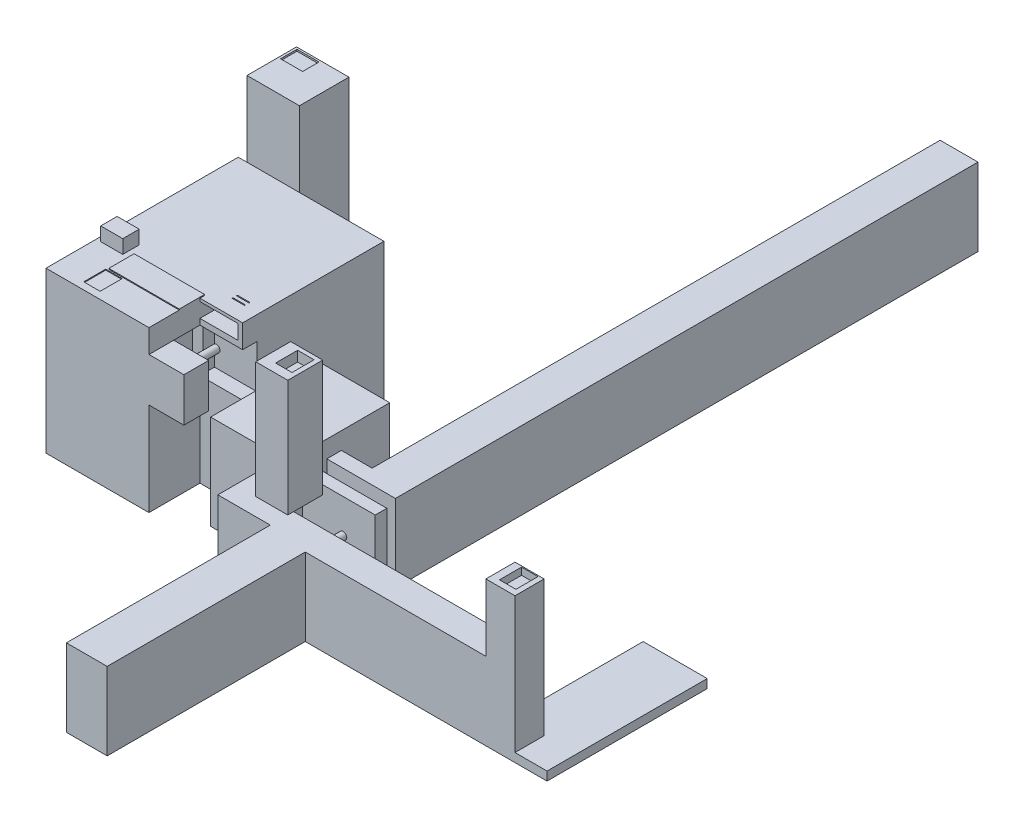
from build123d import *

# Parameters (mm, degrees)
SKETCH1_W            = 500
SKETCH1_H            = 500
BOSS_EXTRUDE1_DEPTH  = 550
SKETCH2_W            = 75.8
SKETCH2_H            = 56.4
BOSS_EXTRUDE2_DEPTH  = 46.8
SKETCH5_W            = 31
SKETCH5_H            = 3.15
BOSS_EXTRUDE4_DEPTH  = 242
SKETCH6_W            = 146.6
SKETCH6_H            = 15
CUT_EXTRUDE2_DEPTH   = 654.834841531
SKETCH7_W            = 353.4
SKETCH7_H            = 550
BOSS_EXTRUDE5_DEPTH  = 160
SKETCH8_W            = 242
SKETCH8_H            = 3.15
BOSS_EXTRUDE6_DEPTH  = 55.8
SKETCH9_W            = 56.4
SKETCH9_H            = 75.8
CUT_EXTRUDE3_DEPTH   = 3.25
CUT_EXTRUDE6_DEPTH   = 10
SKETCH13_W           = 130
SKETCH13_H           = 50
CUT_EXTRUDE7_DEPTH   = 130
LPATTERN1_COUNT      = 2
LPATTERN1_PITCH      = 15
SKETCH14_W           = 146.6
SKETCH14_H           = 150
CUT_EXTRUDE8_DEPTH   = 50
SKETCH15_W           = 350
SKETCH15_H           = 325
BOSS_EXTRUDE7_DEPTH  = 265
SKETCH16_W           = 50
SKETCH16_H           = 266.2
BOSS_EXTRUDE8_DEPTH  = 235.5
SKETCH17_W           = 130
SKETCH17_H           = 266.2
BOSS_EXTRUDE9_DEPTH  = 1950
SKETCH18_W           = 80
SKETCH18_H           = 266.2
BOSS_EXTRUDE10_DEPTH = 160
SKETCH19_W           = 780
SKETCH19_H           = 266.2
BOSS_EXTRUDE11_DEPTH = 240
SKETCH20_W           = 700
SKETCH20_H           = 266.2
CUT_EXTRUDE9_DEPTH   = 100
SKETCH21_W           = 100
SKETCH21_H           = 266.2
BOSS_EXTRUDE12_DEPTH = 720
SKETCH22_W           = 100
SKETCH22_H           = 100
BOSS_EXTRUDE14_DEPTH = 230
SKETCH23_W           = 56.4
SKETCH23_H           = 75.8
CUT_EXTRUDE10_DEPTH  = 24.4
SKETCH24_W           = 40
SKETCH24_H           = 266.2
BOSS_EXTRUDE15_DEPTH = 250
BOSS_EXTRUDE16_REACH = 2623.994
SKETCH25_R           = 12.5
SKETCH26_W           = 110
SKETCH26_H           = 120
BOSS_EXTRUDE22_DEPTH = 365.6
SKETCH28_W           = 110
SKETCH28_H           = 120
SKETCH28_W_2         = 56.4
SKETCH28_H_2         = 75.8
BOSS_EXTRUDE23_DEPTH = 35
SKETCH29_W           = 100
SKETCH29_H           = 150
CUT_EXTRUDE11_DEPTH  = 35
SKETCH30_W           = 85
SKETCH30_H           = 150
BOSS_EXTRUDE24_DEPTH = 120
BOSS_EXTRUDE25_REACH = 2664.563
SKETCH31_R           = 12.5
SKETCH32_W           = 220
SKETCH32_H           = 550
BOSS_EXTRUDE26_DEPTH = 30
SKETCH34_W           = 180
SKETCH34_H           = 808
BOSS_EXTRUDE28_DEPTH = 170
SKETCH35_W           = 75.8
SKETCH35_H           = 56.4
CUT_EXTRUDE12_DEPTH  = 5.8


with BuildPart() as part:
    # Sketch1 → Boss-Extrude1 (new body)
    with BuildSketch(Plane(origin=(0, 0, 0), x_dir=(1, 0, 0), z_dir=(0, 1, 0))):
        Rectangle(SKETCH1_W, SKETCH1_H)
    extrude(amount=BOSS_EXTRUDE1_DEPTH)

    # Sketch2 → Boss-Extrude2 (add)
    with BuildSketch(Plane(origin=(0, 550, 0), x_dir=(1, 0, 0), z_dir=(0, 1, 0))):
        with Locations((-197.1, -209)):
            Rectangle(SKETCH2_W, SKETCH2_H)
    extrude(amount=BOSS_EXTRUDE2_DEPTH)

    # Sketch5 → Boss-Extrude4 (add)
    with BuildSketch(Plane(origin=(-138.6, 0, 0), x_dir=(0, 0, -1), z_dir=(1, 0, 0))):
        with Locations((-234.5, 551.575)):
            Rectangle(SKETCH5_W, SKETCH5_H)
    extrude(amount=BOSS_EXTRUDE4_DEPTH)

    # Sketch6 → Cut-Extrude2 (cut, through all)
    with BuildSketch(Plane(origin=(0, 550, 0), x_dir=(1, 0, 0), z_dir=(0, 1, 0))):
        with Locations((176.7, -242.5)):
            Rectangle(SKETCH6_W, SKETCH6_H)
    extrude(amount=-CUT_EXTRUDE2_DEPTH, mode=Mode.SUBTRACT)

    # Sketch7 → Boss-Extrude5 (add)
    with BuildSketch(Plane.XY.offset(250)):
        with Locations((-73.3, 275)):
            Rectangle(SKETCH7_W, SKETCH7_H)
    extrude(amount=BOSS_EXTRUDE5_DEPTH)

    # Sketch8 → Boss-Extrude6 (add)
    with BuildSketch(Plane.XY.offset(250)):
        with Locations((-17.6, 551.575)):
            Rectangle(SKETCH8_W, SKETCH8_H)
    extrude(amount=BOSS_EXTRUDE6_DEPTH)

    # Sketch9 → Cut-Extrude3 (cut)
    with BuildSketch(Plane(origin=(0, 550, 0), x_dir=(1, 0, 0), z_dir=(0, 1, 0))):
        with Locations((-116.6, -347.9)):
            Rectangle(SKETCH9_W, SKETCH9_H)
    extrude(amount=-CUT_EXTRUDE3_DEPTH, mode=Mode.SUBTRACT)

    # Sketch12 → Cut-Extrude6 (cut)
    with BuildSketch(Plane(origin=(0, 550, 0), x_dir=(1, 0, 0), z_dir=(0, 1, 0))):
        with BuildLine():
            Line((200, -176.7), (160, -176.7))
            ThreePointArc((160, -176.7), (158.3, -178.4), (160, -180.1))
            Line((160, -180.1), (200, -180.1))
            ThreePointArc((200, -180.1), (201.7, -178.4), (200, -176.7))
        make_face()
    cut_extrude6 = extrude(amount=-CUT_EXTRUDE6_DEPTH, mode=Mode.SUBTRACT)

    # Sketch13 → Cut-Extrude7 (cut)
    with BuildSketch(Plane.XY.offset(235)):
        with Locations((168.4, 515)):
            Rectangle(SKETCH13_W, SKETCH13_H)
    extrude(amount=-CUT_EXTRUDE7_DEPTH, mode=Mode.SUBTRACT)

    # LPattern1: Cut-Extrude6 ×2
    with Locations(*[(0, 0, -i * LPATTERN1_PITCH) for i in range(1, LPATTERN1_COUNT)]):
        add(cut_extrude6, mode=Mode.SUBTRACT)

    # Sketch14 → Cut-Extrude8 (cut)
    with BuildSketch(Plane.XY.offset(235)):
        with Locations((176.7, 395)):
            Rectangle(SKETCH14_W, SKETCH14_H)
    extrude(amount=-CUT_EXTRUDE8_DEPTH, mode=Mode.SUBTRACT)

    # Sketch15 → Boss-Extrude7 (add)
    with BuildSketch(Plane(origin=(250, 0, 0), x_dir=(0, 0, -1), z_dir=(1, 0, 0))):
        with Locations((-170, 162.5)):
            Rectangle(SKETCH15_W, SKETCH15_H)
    extrude(amount=BOSS_EXTRUDE7_DEPTH)

    # Sketch16 → Boss-Extrude8 (add)
    with BuildSketch(Plane(origin=(515, 0, 0), x_dir=(0, 0, -1), z_dir=(1, 0, 0))):
        with Locations((-186, 133.1)):
            Rectangle(SKETCH16_W, SKETCH16_H)
    extrude(amount=BOSS_EXTRUDE8_DEPTH)

    # Sketch17 → Boss-Extrude9 (add)
    with BuildSketch(Plane(origin=(0, 0, 161), x_dir=(-1, 0, 0), z_dir=(0, 0, -1))):
        with Locations((-685.5, 133.1)):
            Rectangle(SKETCH17_W, SKETCH17_H)
    extrude(amount=BOSS_EXTRUDE9_DEPTH)

    # Sketch18 → Boss-Extrude10 (add)
    with BuildSketch(Plane.XY.offset(345)):
        with Locations((475, 133.1)):
            Rectangle(SKETCH18_W, SKETCH18_H)
    extrude(amount=BOSS_EXTRUDE10_DEPTH)

    # Sketch19 → Boss-Extrude11 (add)
    with BuildSketch(Plane(origin=(515, 0, 0), x_dir=(0, 0, -1), z_dir=(1, 0, 0))):
        with Locations((-815, 133.1)):
            Rectangle(SKETCH19_W, SKETCH19_H)
    extrude(amount=BOSS_EXTRUDE11_DEPTH)

    # Sketch20 → Cut-Extrude9 (cut)
    with BuildSketch(Plane.ZY.offset(-515)):
        with Locations((855, 133.1)):
            Rectangle(SKETCH20_W, SKETCH20_H)
    extrude(amount=-CUT_EXTRUDE9_DEPTH, mode=Mode.SUBTRACT)

    # Sketch21 → Boss-Extrude12 (add)
    with BuildSketch(Plane(origin=(755, 0, 0), x_dir=(0, 0, -1), z_dir=(1, 0, 0))):
        with Locations((-475, 133.1)):
            Rectangle(SKETCH21_W, SKETCH21_H)
    extrude(amount=BOSS_EXTRUDE12_DEPTH)

    # Sketch22 → Boss-Extrude14 (add)
    with BuildSketch(Plane(origin=(0, 266.2, 0), x_dir=(1, 0, 0), z_dir=(0, 1, 0))):
        with Locations((1425, -475)):
            Rectangle(SKETCH22_W, SKETCH22_H)
    extrude(amount=BOSS_EXTRUDE14_DEPTH)

    # Sketch23 → Cut-Extrude10 (cut)
    with BuildSketch(Plane(origin=(0, 496.2, 0), x_dir=(1, 0, 0), z_dir=(0, 1, 0))):
        with Locations((1429.3, -466.45)):
            Rectangle(SKETCH23_W, SKETCH23_H)
    extrude(amount=-CUT_EXTRUDE10_DEPTH, mode=Mode.SUBTRACT)

    # Sketch24 → Boss-Extrude15 (add)
    with BuildSketch(Plane(origin=(515, 0, 0), x_dir=(0, 0, -1), z_dir=(1, 0, 0))):
        with Locations((-275, 133.1)):
            Rectangle(SKETCH24_W, SKETCH24_H)
    extrude(amount=BOSS_EXTRUDE15_DEPTH)

    # Sketch25 → Boss-Extrude16 (add, up to next)
    with BuildSketch(Plane.XY.offset(295), mode=Mode.PRIVATE) as boss_extrude16_sk1:
        with Locations((655, 150)):
            Circle(SKETCH25_R)
    boss_extrude16_tool1 = extrude(boss_extrude16_sk1.sketch, amount=BOSS_EXTRUDE16_REACH, mode=Mode.PRIVATE) - part.part
    add(boss_extrude16_tool1.solids().sort_by_distance((655, 150, 295))[0])

    # Sketch26 → Boss-Extrude22 (add)
    with BuildSketch(Plane(origin=(0, 266.2, 0), x_dir=(1, 0, 0), z_dir=(0, 1, 0))):
        with Locations((560, -385)):
            Rectangle(SKETCH26_W, SKETCH26_H)
    extrude(amount=BOSS_EXTRUDE22_DEPTH)

    # Sketch28 → Boss-Extrude23 (add)
    with BuildSketch(Plane(origin=(0, 631.8, 0), x_dir=(1, 0, 0), z_dir=(0, 1, 0))):
        with Locations((560, -385)):
            Rectangle(SKETCH28_W, SKETCH28_H)
        with Locations((570.98, -376.8)):
            Rectangle(SKETCH28_W_2, SKETCH28_H_2, mode=Mode.SUBTRACT)
    extrude(amount=BOSS_EXTRUDE23_DEPTH)

    # Sketch29 → Cut-Extrude11 (cut)
    with BuildSketch(Plane(origin=(103.4, 0, 0), x_dir=(0, 0, -1), z_dir=(1, 0, 0))):
        with Locations((-275, 395)):
            Rectangle(SKETCH29_W, SKETCH29_H)
    extrude(amount=-CUT_EXTRUDE11_DEPTH, mode=Mode.SUBTRACT)

    # Sketch30 → Boss-Extrude24 (add)
    with BuildSketch(Plane(origin=(103.4, 0, 0), x_dir=(0, 0, -1), z_dir=(1, 0, 0))):
        with Locations((-367.5, 395)):
            Rectangle(SKETCH30_W, SKETCH30_H)
    extrude(amount=BOSS_EXTRUDE24_DEPTH)

    # Sketch31 → Boss-Extrude25 (add, up to next)
    with BuildSketch(Plane(origin=(0, 0, 325), x_dir=(-1, 0, 0), z_dir=(0, 0, -1)), mode=Mode.PRIVATE) as boss_extrude25_sk1:
        with Locations((-109.9, 378.75)):
            Circle(SKETCH31_R)
    boss_extrude25_tool1 = extrude(boss_extrude25_sk1.sketch, amount=BOSS_EXTRUDE25_REACH, mode=Mode.PRIVATE) - part.part
    add(boss_extrude25_tool1.solids().sort_by_distance((109.9, 378.75, 325))[0])

    # Sketch32 → Boss-Extrude26 (add)
    with BuildSketch(Plane.XZ):
        with Locations((1475, 250)):
            Rectangle(SKETCH32_W, SKETCH32_H)
    extrude(amount=-BOSS_EXTRUDE26_DEPTH)

    # Sketch34 → Boss-Extrude28 (add)
    with BuildSketch(Plane(origin=(0, 0, -250), x_dir=(-1, 0, 0), z_dir=(0, 0, -1))):
        with Locations((130, 404)):
            Rectangle(SKETCH34_W, SKETCH34_H)
    extrude(amount=BOSS_EXTRUDE28_DEPTH)

    # Sketch35 → Cut-Extrude12 (cut)
    with BuildSketch(Plane(origin=(0, 808, 0), x_dir=(1, 0, 0), z_dir=(0, 1, 0))):
        with Locations((-174.2, 385.4)):
            Rectangle(SKETCH35_W, SKETCH35_H)
    extrude(amount=-CUT_EXTRUDE12_DEPTH, mode=Mode.SUBTRACT)


solid = part.part
